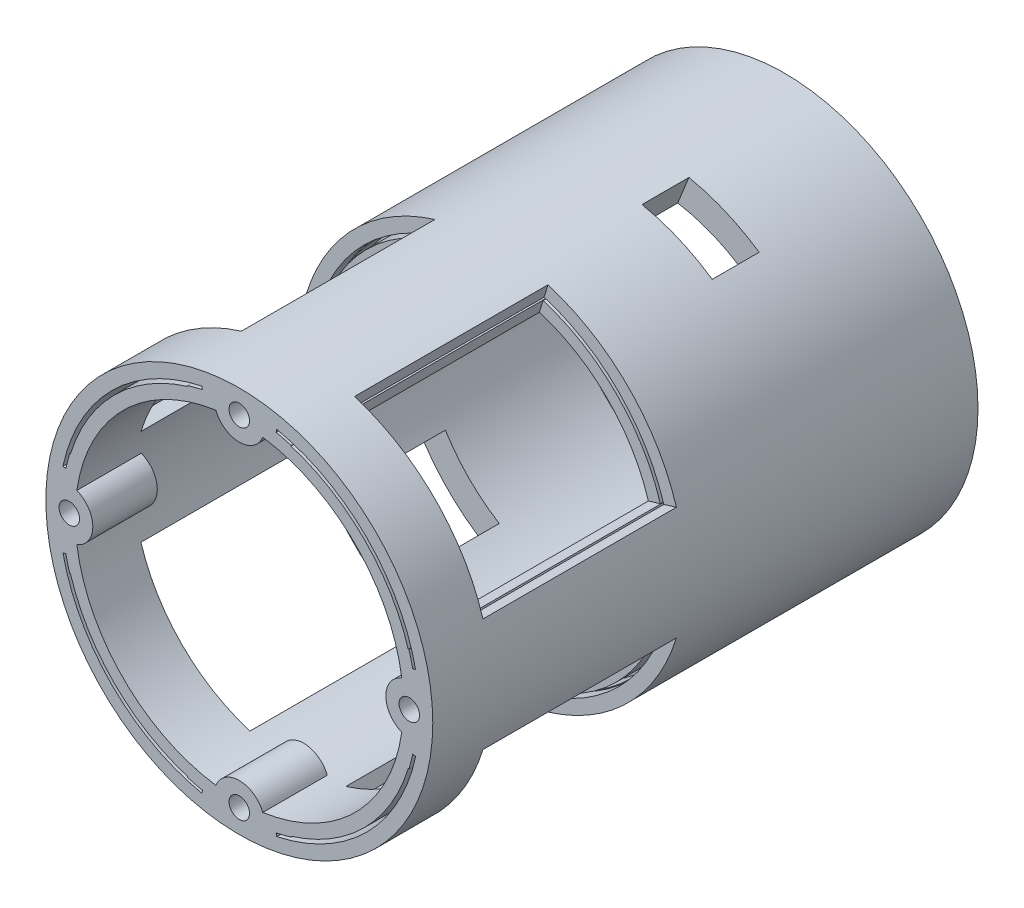
from build123d import *

# Parameters (mm, degrees)
CROQUIS1_R               = 33
CROQUIS1_R_2             = 28
BOSS_EXTRUDE1_DEPTH      = 93
CORTAR_EXTRUIR1_DEPTH    = 45
CORTAR_REVOLUCI_N2_ANGLE = 56
MATRIZC2_COUNT           = 4
BOSS_EXTRUDE4_DEPTH      = 11
SKETCH9_R                = 1.75
CUT_EXTRUDE3_DEPTH       = 10
SKETCH10_W               = 7
SKETCH10_H               = 15
SKETCH10_W_2             = 8
SKETCH10_H_2             = 13
CORTE_USB_Y_SWITCH_DEPTH = 10
SKETCH11_W               = 8
SKETCH11_H               = 13
CUT_EXTRUDE5_DEPTH       = 10


with BuildPart() as part:
    # Croquis1 → Boss-Extrude1 (new body)
    with BuildSketch(Plane.XY):
        Circle(CROQUIS1_R)
        Circle(CROQUIS1_R_2, mode=Mode.SUBTRACT)
    extrude(amount=BOSS_EXTRUDE1_DEPTH)

    # Croquis2 → Cortar-Extruir1 (cut)
    with BuildSketch(Plane.XY.offset(93)):
        with BuildLine():
            Line((-30.078038723, -6.393284493), (-29.588964922, -6.289328647))
            ThreePointArc((-29.588964922, -6.289328647), (-21.389980131, -21.389980131), (-6.289328647, -29.588964922))
            Line((-6.289328647, -29.588964922), (-6.393284493, -30.078038723))
            ThreePointArc((-6.393284493, -30.078038723), (-21.743533521, -21.743533521), (-30.078038723, -6.393284493))
        make_face()
        with BuildLine():
            Line((-30.078038723, 6.393284493), (-29.588964922, 6.289328647))
            ThreePointArc((-29.588964922, 6.289328647), (-21.389980131, 21.389980131), (-6.289328647, 29.588964922))
            Line((-6.289328647, 29.588964922), (-6.393284493, 30.078038723))
            ThreePointArc((-6.393284493, 30.078038723), (-21.743533521, 21.743533521), (-30.078038723, 6.393284493))
        make_face()
        with BuildLine():
            Line((6.393284493, 30.078038723), (6.289328647, 29.588964922))
            ThreePointArc((6.289328647, 29.588964922), (21.389980131, 21.389980131), (29.588964922, 6.289328647))
            Line((29.588964922, 6.289328647), (30.078038723, 6.393284493))
            ThreePointArc((30.078038723, 6.393284493), (21.743533521, 21.743533521), (6.393284493, 30.078038723))
        make_face()
        with BuildLine():
            Line((30.078038723, -6.393284493), (29.588964922, -6.289328647))
            ThreePointArc((29.588964922, -6.289328647), (21.389980131, -21.389980131), (6.289328647, -29.588964922))
            Line((6.289328647, -29.588964922), (6.393284493, -30.078038723))
            ThreePointArc((6.393284493, -30.078038723), (21.743533521, -21.743533521), (30.078038723, -6.393284493))
        make_face()
    extrude(amount=-CORTAR_EXTRUIR1_DEPTH, mode=Mode.SUBTRACT)

    # Croquis4 → Cortar-Revolución2 (revolve, cut)
    with BuildSketch(Plane(origin=(0, 0, 0), x_dir=(0, 0, -1), z_dir=(0.9563047559630379, -0.29237170472272933, 0))):
        Polygon((-83, 33), (-83, 30.633938292), (-93, 30.633938292), (-93, 30.133938292), (-83, 30.133938292), (-83, 27.767876584), (-50, 27.767876584), (-50, 30.133938292), (-45, 30.133938292), (-45, 30.633938292), (-50, 30.633938292), (-50, 33), align=None)
    cortar_revoluci_n2 = revolve(axis=Axis((0, 0, 93), (0, 0, -1)), revolution_arc=CORTAR_REVOLUCI_N2_ANGLE, mode=Mode.SUBTRACT)

    # MatrizC2: Cortar-Revolución2 ×4 about axis
    matrizc2_axis = Axis((0, 0, 93), (0, 0, -1))
    for i in range(1, MATRIZC2_COUNT):
        add(cortar_revoluci_n2.rotate(matrizc2_axis, i * 360 / MATRIZC2_COUNT), mode=Mode.SUBTRACT)

    # Sketch8 → Boss-Extrude4 (add)
    with BuildSketch(Plane(origin=(0, 0, 0), x_dir=(-1, 0, 0), z_dir=(0, 0, -1))):
        with BuildLine():
            ThreePointArc((-4, -27.712812921), (0, -28), (4, -27.712812921))
            ThreePointArc((4, -27.712812921), (0, -24.990786305), (-4, -27.712812921))
        make_face()
        with BuildLine():
            ThreePointArc((-27.712812921, 4), (-28, 0), (-27.712812921, -4))
            ThreePointArc((-27.712812921, -4), (-24.990786305, 0), (-27.712812921, 4))
        make_face()
        with BuildLine():
            ThreePointArc((4, 27.712812921), (0, 28), (-4, 27.712812921))
            ThreePointArc((-4, 27.712812921), (0, 24.990786305), (4, 27.712812921))
        make_face()
        with BuildLine():
            ThreePointArc((27.712812921, -4), (28, 0), (27.712812921, 4))
            ThreePointArc((27.712812921, 4), (24.990786305, 0), (27.712812921, -4))
        make_face()
    boss_extrude4 = extrude(amount=-BOSS_EXTRUDE4_DEPTH)

    # Sketch9 → Cut-Extrude3 (cut)
    with BuildSketch(Plane(origin=(0, 0, 0), x_dir=(-1, 0, 0), z_dir=(0, 0, -1))):
        with Locations((0, -29)):
            Circle(SKETCH9_R)
        with Locations((-29, 0)):
            Circle(SKETCH9_R)
        with Locations((0, 29)):
            Circle(SKETCH9_R)
        with Locations((29, 0)):
            Circle(SKETCH9_R)
    cut_extrude3 = extrude(amount=-CUT_EXTRUDE3_DEPTH, mode=Mode.SUBTRACT)

    # Mirror1: Boss-Extrude4, Cut-Extrude3 across plane
    add(boss_extrude4.mirror(Plane.XY.offset(46.5)))
    add(cut_extrude3.mirror(Plane.XY.offset(46.5)), mode=Mode.SUBTRACT)

    # Sketch10 → Corte USB y Switch (cut)
    with BuildSketch(Plane(origin=(-23.334523779, -23.334523779, 0), x_dir=(0, 0, -1), z_dir=(-0.7071067811865488, -0.7071067811865464, 0))):
        with Locations((-7, 0)):
            Rectangle(SKETCH10_W, SKETCH10_H)
        with Locations((-38, 0)):
            Rectangle(SKETCH10_W_2, SKETCH10_H_2)
    extrude(amount=-CORTE_USB_Y_SWITCH_DEPTH, mode=Mode.SUBTRACT)

    # Sketch11 → Cut-Extrude5 (cut)
    with BuildSketch(Plane(origin=(12.362017583, 30.597067201, 0), x_dir=(0, 0, -1), z_dir=(0.37460659341590646, 0.9271838545667896, 0))):
        with Locations((-26.9, -0.5)):
            Rectangle(SKETCH11_W, SKETCH11_H)
    extrude(amount=-CUT_EXTRUDE5_DEPTH, mode=Mode.SUBTRACT)


solid = part.part
